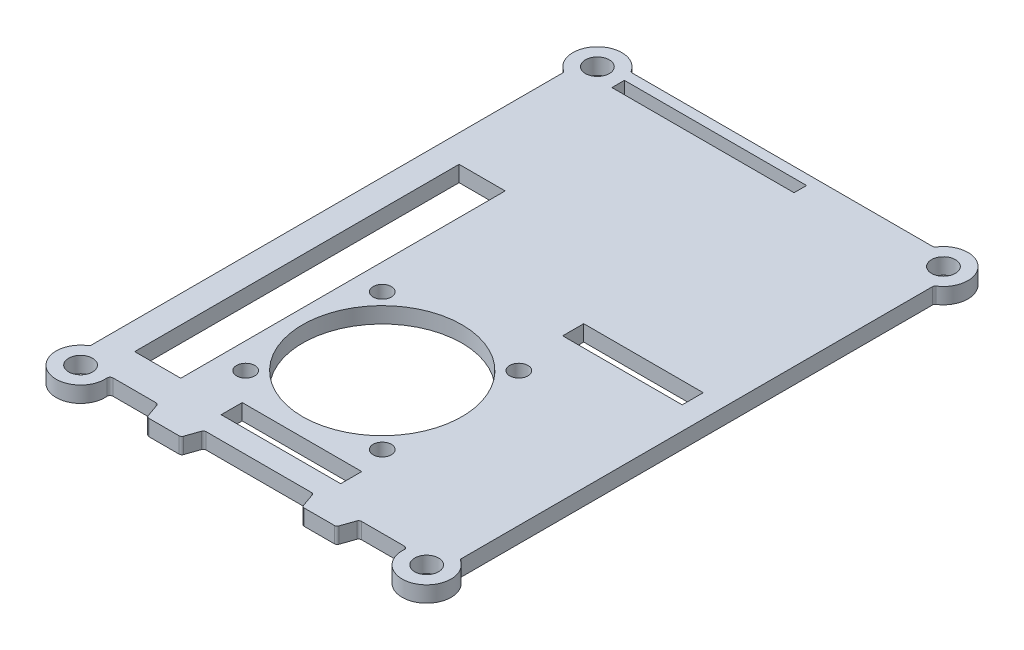
from build123d import *

# Parameters (mm, degrees)
BASEPLATE_OUTLINE_R = 2.1
BASEPLATE_DEPTH     = 2.8
CUT_EXTRUDE1_REACH  = 115.438
SKETCH3_R           = 14
SKETCH3_R_2         = 1.6
SKETCH3_W           = 21
SKETCH3_H           = 3.7
SKETCH3_W_2         = 32
SKETCH3_H_2         = 2.2
SKETCH3_W_3         = 8.1
SKETCH3_H_3         = 57


# Read off the part's stored shape, not the designer's step: BasePlate
with BuildPart() as part:
    # BasePlate outline → BasePlate (new body)
    with BuildSketch(Plane(origin=(0, 0, 0), x_dir=(1, 0, 0), z_dir=(0, 1, 0))):
        with BuildLine():
            Line((43.502626614, -5.852332608), (48.792614178, -5.852332608))
            ThreePointArc((48.792614178, -5.852332608), (49.082078508, -5.760021707), (49.264659986, -5.517174213))
            Line((49.264659986, -5.517174213), (50.078201202, -3.187491002))
            ThreePointArc((50.078201202, -3.187491002), (50.26078268, -2.944643509), (50.55024701, -2.852332608))
            Line((50.55024701, -2.852332608), (58.116695703, -2.852332608))
            ThreePointArc((58.116695703, -2.852332608), (58.484685739, -3.013831008), (58.614956567, -3.393999275))
            ThreePointArc((58.614956567, -3.393999275), (64.799237397, -7.61016844), (65.229166667, -0.137781095))
            ThreePointArc((65.229166667, -0.137781095), (65.061014427, 0.043158816), (65, 0.282515593))
            Line((65, 0.282515593), (65, 83.012819192))
            ThreePointArc((65, 83.012819192), (65.061014427, 83.252175969), (65.229166667, 83.433115879))
            ThreePointArc((65.229166667, 83.433115879), (65.940559159, 90.088226551), (59.285448487, 89.376834059))
            ThreePointArc((59.285448487, 89.376834059), (59.104508577, 89.208681819), (58.8651518, 89.147667392))
            Line((58.8651518, 89.147667392), (6.1348482, 89.147667392))
            ThreePointArc((6.1348482, 89.147667392), (5.895491423, 89.208681819), (5.714551513, 89.376834059))
            ThreePointArc((5.714551513, 89.376834059), (-0.940559159, 90.088226551), (-0.229166667, 83.433115879))
            ThreePointArc((-0.229166667, 83.433115879), (-0.061014427, 83.252175969), (0, 83.012819192))
            Line((0, 83.012819192), (0, 0.282515593))
            ThreePointArc((0, 0.282515593), (-0.061014427, 0.043158816), (-0.229166667, -0.137781095))
            ThreePointArc((-0.229166667, -0.137781095), (0.200762603, -7.61016844), (6.385043433, -3.393999275))
            ThreePointArc((6.385043433, -3.393999275), (6.515314261, -3.013831008), (6.883304297, -2.852332608))
            Line((6.883304297, -2.852332608), (14.44975299, -2.852332608))
            ThreePointArc((14.44975299, -2.852332608), (14.73921732, -2.944643509), (14.921798798, -3.187491002))
            Line((14.921798798, -3.187491002), (15.735340014, -5.517174213))
            ThreePointArc((15.735340014, -5.517174213), (15.917921492, -5.760021707), (16.207385822, -5.852332608))
            Line((16.207385822, -5.852332608), (21.497373386, -5.852332608))
            ThreePointArc((21.497373386, -5.852332608), (21.786837716, -5.760021707), (21.969419194, -5.517174213))
            Line((21.969419194, -5.517174213), (22.78296041, -3.187491002))
            ThreePointArc((22.78296041, -3.187491002), (22.965541888, -2.944643509), (23.255006218, -2.852332608))
            Line((23.255006218, -2.852332608), (41.744993782, -2.852332608))
            ThreePointArc((41.744993782, -2.852332608), (42.034458112, -2.944643509), (42.21703959, -3.187491002))
            Line((42.21703959, -3.187491002), (43.030580806, -5.517174213))
            ThreePointArc((43.030580806, -5.517174213), (43.213162284, -5.760021707), (43.502626614, -5.852332608))
        make_face()
        with Locations((2.1, -3.752332608)):
            Circle(BASEPLATE_OUTLINE_R, mode=Mode.SUBTRACT)
        with Locations((62.9, -3.752332608)):
            Circle(BASEPLATE_OUTLINE_R, mode=Mode.SUBTRACT)
        with Locations((2.1, 87.047667392)):
            Circle(BASEPLATE_OUTLINE_R, mode=Mode.SUBTRACT)
        with Locations((62.9, 87.047667392)):
            Circle(BASEPLATE_OUTLINE_R, mode=Mode.SUBTRACT)
    extrude(amount=BASEPLATE_DEPTH)

    # Sketch3 → Cut-Extrude1 (cut, up to next)
    with BuildSketch(Plane(origin=(0, 2.8, 0), x_dir=(1, 0, 0), z_dir=(0, 1, 0)), mode=Mode.PRIVATE) as cut_extrude1_sk1:
        with Locations(Location((29.45, 21.897667392, 0), (0, 0, 270))):
            Circle(SKETCH3_R)
    cut_extrude1_tool1 = extrude(cut_extrude1_sk1.sketch, amount=-CUT_EXTRUDE1_REACH, mode=Mode.PRIVATE) & part.part
    # Sketch3 → Cut-Extrude1 (cut, up to next)
    with BuildSketch(Plane(origin=(0, 2.8, 0), x_dir=(1, 0, 0), z_dir=(0, 1, 0)), mode=Mode.PRIVATE) as cut_extrude1_sk2:
        with Locations(Location((41.45, 33.897667392, 0), (0, 0, 270))):
            Circle(SKETCH3_R_2)
    cut_extrude1_tool2 = extrude(cut_extrude1_sk2.sketch, amount=-CUT_EXTRUDE1_REACH, mode=Mode.PRIVATE) & part.part
    # Sketch3 → Cut-Extrude1 (cut, up to next)
    with BuildSketch(Plane(origin=(0, 2.8, 0), x_dir=(1, 0, 0), z_dir=(0, 1, 0)), mode=Mode.PRIVATE) as cut_extrude1_sk3:
        with Locations(Location((41.45, 9.897667392, 0), (0, 0, 270))):
            Circle(SKETCH3_R_2)
    cut_extrude1_tool3 = extrude(cut_extrude1_sk3.sketch, amount=-CUT_EXTRUDE1_REACH, mode=Mode.PRIVATE) & part.part
    # Sketch3 → Cut-Extrude1 (cut, up to next)
    with BuildSketch(Plane(origin=(0, 2.8, 0), x_dir=(1, 0, 0), z_dir=(0, 1, 0)), mode=Mode.PRIVATE) as cut_extrude1_sk4:
        with Locations(Location((17.45, 9.897667392, 0), (0, 0, 270))):
            Circle(SKETCH3_R_2)
    cut_extrude1_tool4 = extrude(cut_extrude1_sk4.sketch, amount=-CUT_EXTRUDE1_REACH, mode=Mode.PRIVATE) & part.part
    # Sketch3 → Cut-Extrude1 (cut, up to next)
    with BuildSketch(Plane(origin=(0, 2.8, 0), x_dir=(1, 0, 0), z_dir=(0, 1, 0)), mode=Mode.PRIVATE) as cut_extrude1_sk5:
        with Locations(Location((17.45, 33.897667392, 0), (0, 0, 270))):
            Circle(SKETCH3_R_2)
    cut_extrude1_tool5 = extrude(cut_extrude1_sk5.sketch, amount=-CUT_EXTRUDE1_REACH, mode=Mode.PRIVATE) & part.part
    # Sketch3 → Cut-Extrude1 (cut, up to next)
    with BuildSketch(Plane(origin=(0, 2.8, 0), x_dir=(1, 0, 0), z_dir=(0, 1, 0)), mode=Mode.PRIVATE) as cut_extrude1_sk6:
        with Locations((32.5, 2.897667392)):
            Rectangle(SKETCH3_W, SKETCH3_H)
    cut_extrude1_tool6 = extrude(cut_extrude1_sk6.sketch, amount=-CUT_EXTRUDE1_REACH, mode=Mode.PRIVATE) & part.part
    # Sketch3 → Cut-Extrude1 (cut, up to next)
    with BuildSketch(Plane(origin=(0, 2.8, 0), x_dir=(1, 0, 0), z_dir=(0, 1, 0)), mode=Mode.PRIVATE) as cut_extrude1_sk7:
        with Locations((50.5, 44.897667392)):
            Rectangle(SKETCH3_W, SKETCH3_H)
    cut_extrude1_tool7 = extrude(cut_extrude1_sk7.sketch, amount=-CUT_EXTRUDE1_REACH, mode=Mode.PRIVATE) & part.part
    # Sketch3 → Cut-Extrude1 (cut, up to next)
    with BuildSketch(Plane(origin=(0, 2.8, 0), x_dir=(1, 0, 0), z_dir=(0, 1, 0)), mode=Mode.PRIVATE) as cut_extrude1_sk8:
        with Locations((22.55, 86.247667392)):
            Rectangle(SKETCH3_W_2, SKETCH3_H_2)
    cut_extrude1_tool8 = extrude(cut_extrude1_sk8.sketch, amount=-CUT_EXTRUDE1_REACH, mode=Mode.PRIVATE) & part.part
    # Sketch3 → Cut-Extrude1 (cut, up to next)
    with BuildSketch(Plane(origin=(0, 2.8, 0), x_dir=(1, 0, 0), z_dir=(0, 1, 0)), mode=Mode.PRIVATE) as cut_extrude1_sk9:
        with Locations((8.85, 31.547667392)):
            Rectangle(SKETCH3_W_3, SKETCH3_H_3)
    cut_extrude1_tool9 = extrude(cut_extrude1_sk9.sketch, amount=-CUT_EXTRUDE1_REACH, mode=Mode.PRIVATE) & part.part
    add(cut_extrude1_tool1.solids().sort_by_distance((29.45, 2.8, -21.897667))[0], mode=Mode.SUBTRACT)
    add(cut_extrude1_tool2.solids().sort_by_distance((41.45, 2.8, -33.897667))[0], mode=Mode.SUBTRACT)
    add(cut_extrude1_tool3.solids().sort_by_distance((41.45, 2.8, -9.897667))[0], mode=Mode.SUBTRACT)
    add(cut_extrude1_tool4.solids().sort_by_distance((17.45, 2.8, -9.897667))[0], mode=Mode.SUBTRACT)
    add(cut_extrude1_tool5.solids().sort_by_distance((17.45, 2.8, -33.897667))[0], mode=Mode.SUBTRACT)
    add(cut_extrude1_tool6.solids().sort_by_distance((32.5, 2.8, -2.897667))[0], mode=Mode.SUBTRACT)
    add(cut_extrude1_tool7.solids().sort_by_distance((50.5, 2.8, -44.897667))[0], mode=Mode.SUBTRACT)
    add(cut_extrude1_tool8.solids().sort_by_distance((22.55, 2.8, -86.247667))[0], mode=Mode.SUBTRACT)
    add(cut_extrude1_tool9.solids().sort_by_distance((8.85, 2.8, -31.547667))[0], mode=Mode.SUBTRACT)


solid = part.part
